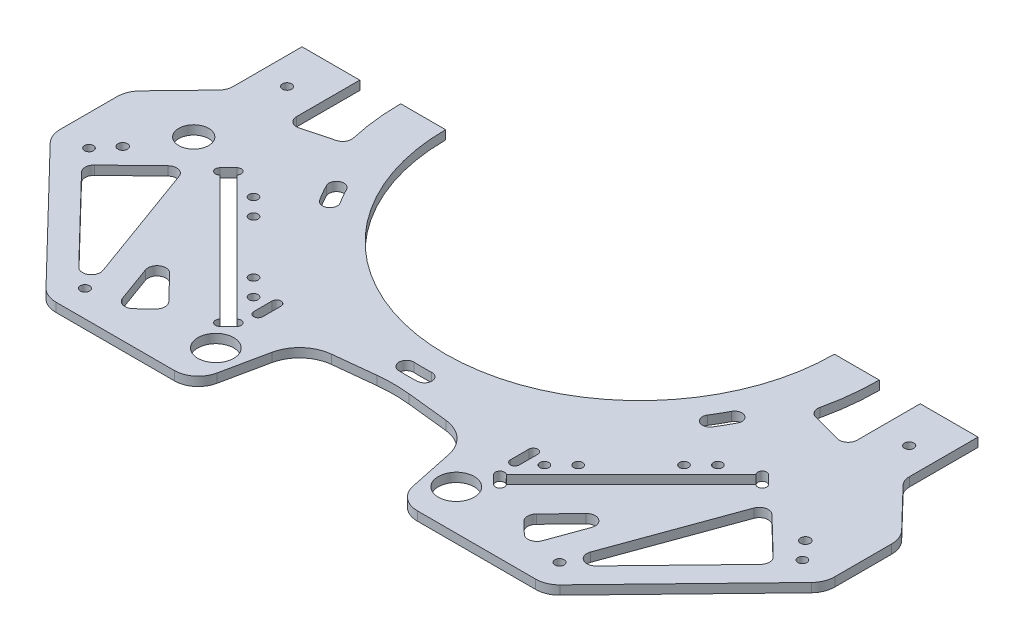
from build123d import *

# Parameters (mm, degrees)
SKETCH_2_R                                 = 1.5
SKETCH_2_R_2                               = 6
SKETCH_2_R_3                               = 2.5
SKETCH_2_R_4                               = 65
EXTRUDE_1_DEPTH                            = 3
CUT_EXTRUDE_1_DEPTH                        = 10
SKETCH_4_W                                 = 371.78166001
SKETCH_4_H                                 = 92.770790776
CUT_EXTRUDE_2_DEPTH                        = 10
CUT_EXTRUDE_3_DEPTH                        = 10
CUT_EXTRUDE_4_DEPTH                        = 10
MIRROR_3_COPY_1_DEPTH                      = 10
MIRROR_3_COPY_2_DEPTH                      = 10
SKETCH_13_R                                = 1.5
CUT_EXTRUDE_7_DEPTH                        = 10
MIRROR_4_AT_THE_SECOND_PLANE_COPY_1_SKET_R = 1.5
MIRROR_4_AT_THE_SECOND_PLANE_COPY_1_DEPTH  = 10
CUT_EXTRUDE_8_DEPTH                        = 10
FILLET_1_R                                 = 10
CUT_EXTRUDE_9_DEPTH                        = 10
FILLET_3_R                                 = 3
MIRROR_START                               = -3
MIRROR_7_DEPTH                             = 3
FILLET_4_R                                 = 10
SKETCH_27_R                                = 6
EXTRUDE_2_DEPTH                            = 3
CUT_EXTRUDE_10_DEPTH                       = 3
MIRROR_11_COPY_1_DEPTH                     = 3
FILLET_5_R                                 = 8
SKETCH_30_R                                = 5
CUT_EXTRUDE_11_DEPTH                       = 3
CUT_EXTRUDE_12_DEPTH                       = 3
FILLET_6_R                                 = 3
CUT_EXTRUDE_13_DEPTH                       = 3
FILLET_7_R                                 = 5
CUT_EXTRUDE_15_DEPTH                       = 10
PATTERN_CIRCULAR_1_COUNT                   = 6
CUT_EXTRUDE_16_DEPTH                       = 3
FILLET_8_R                                 = 8
SKETCH_35_R                                = 1.6
SKETCH_35_R_2                              = 1.55
CUT_EXTRUDE_17_DEPTH                       = 3
SKETCH_36_W                                = 499.129874376
SKETCH_36_H                                = 160.572305111
CUT_EXTRUDE_18_DEPTH                       = 3


# Read off the part's stored shape, not the designer's step: 镜向7
with BuildPart() as part:
    # 草图2 → 凸台-拉伸1 (new body)
    with BuildSketch(Plane(origin=(0, 0, 0), x_dir=(1, 0, 0), z_dir=(0, 1, 0))):
        with BuildLine():
            Line((27.570452121, -570.945673808), (-65.284171465, -616.487071224))
            ThreePointArc((-65.284171465, -616.487071224), (-70.183566605, -620.913167557), (-72, -627.260999566))
            Line((-72, -627.260999566), (-72, -702.260999566))
            ThreePointArc((-72, -702.260999566), (-71.124572855, -706.760319382), (-68.626020199, -710.60316808))
            Line((-68.626020199, -710.60316808), (-4.161661177, -777.260999566))
            Line((-4.161661177, -777.260999566), (18.01022402, -777.260999566))
            ThreePointArc((18.01022402, -777.260999566), (25.574796805, -774.5764297), (29.754765565, -767.723872662))
            Line((29.754765565, -767.723872662), (35.416944963, -740.723008804))
            ThreePointArc((35.416944963, -740.723008804), (39.119130023, -734.339507602), (45.85666052, -731.329367302))
            Line((45.85666052, -731.329367302), (59.628943001, -729.841322608))
            ThreePointArc((59.628943001, -729.841322608), (65, -729.552003017), (70.371056999, -729.841322608))
            Line((70.371056999, -729.841322608), (84.14333948, -731.329367302))
            ThreePointArc((84.14333948, -731.329367302), (90.88747655, -734.345456618), (94.586801163, -740.740390313))
            Line((94.586801163, -740.740390313), (100.245234435, -767.723872662))
            ThreePointArc((100.245234435, -767.723872662), (104.425203195, -774.5764297), (111.98977598, -777.260999566))
            Line((111.98977598, -777.260999566), (134.161661177, -777.260999566))
            Line((134.161661177, -777.260999566), (198.626020199, -710.60316808))
            ThreePointArc((198.626020199, -710.60316808), (201.124572855, -706.760319382), (202, -702.260999566))
            Line((202, -702.260999566), (202, -627.260999566))
            ThreePointArc((202, -627.260999566), (200.183566605, -620.913167557), (195.284171465, -616.487071224))
            Line((195.284171465, -616.487071224), (102.429547879, -570.945673808))
            ThreePointArc((102.429547879, -570.945673808), (65, -562.260999566), (27.570452121, -570.945673808))
        make_face()
        with Locations(Location((-54.25, -712.220291709, 0), (0, 0, 270))):
            Circle(SKETCH_2_R, mode=Mode.SUBTRACT)
        with Locations(Location((24.797056939, -748.876687148, 0), (0, 0, 270))):
            Circle(SKETCH_2_R_2, mode=Mode.SUBTRACT)
        with BuildLine():
            Line((20.591308189, -731.989656145), (20.591308189, -725.864180236))
            ThreePointArc((20.591308189, -725.864180236), (22.091308189, -724.364180236), (23.591308189, -725.864180236))
            Line((23.591308189, -725.864180236), (23.591308189, -731.989656145))
            ThreePointArc((23.591308189, -731.989656145), (22.091308189, -733.489656145), (20.591308189, -731.989656145))
        make_face(mode=Mode.SUBTRACT)
        with Locations(Location((-60, -702.260999566, 0), (0, 0, 270))):
            Circle(SKETCH_2_R_2, mode=Mode.SUBTRACT)
        with Locations(Location((-0.081809094, -684.835999566, 0), (0, 0, 270))):
            Circle(SKETCH_2_R_3, mode=Mode.SUBTRACT)
        with Locations(Location((105.202943061, -748.876687148, 0), (0, 0, 270))):
            Circle(SKETCH_2_R_2, mode=Mode.SUBTRACT)
        with BuildLine():
            ThreePointArc((65, -724.910999566), (62.5, -722.410999566), (65, -719.910999566))
            ThreePointArc((65, -719.910999566), (67.5, -722.410999566), (65, -724.910999566))
        make_face(mode=Mode.SUBTRACT)
        with BuildLine():
            ThreePointArc((106.408691811, -725.864180236), (107.908691811, -724.364180236), (109.408691811, -725.864180236))
            Line((109.408691811, -725.864180236), (109.408691811, -731.989656145))
            ThreePointArc((109.408691811, -731.989656145), (107.908691811, -733.489656145), (106.408691811, -731.989656145))
            Line((106.408691811, -731.989656145), (106.408691811, -725.864180236))
        make_face(mode=Mode.SUBTRACT)
        with Locations(Location((184.25, -712.220291709, 0), (0, 0, 270))):
            Circle(SKETCH_2_R, mode=Mode.SUBTRACT)
        with Locations(Location((130.081809094, -684.835999566, 0), (0, 0, 270))):
            Circle(SKETCH_2_R_3, mode=Mode.SUBTRACT)
        with Locations(Location((190, -702.260999566, 0), (0, 0, 270))):
            Circle(SKETCH_2_R_2, mode=Mode.SUBTRACT)
        with Locations(Location((-60, -627.260999566, 0), (0, 0, 270))):
            Circle(SKETCH_2_R_2, mode=Mode.SUBTRACT)
        with Locations(Location((-54.25, -617.301707422, 0), (0, 0, 270))):
            Circle(SKETCH_2_R, mode=Mode.SUBTRACT)
        with Locations(Location((65, -647.260999566, 0), (0, 0, 270))):
            Circle(SKETCH_2_R_4, mode=Mode.SUBTRACT)
        with Locations(Location((-0.081809094, -609.685999566, 0), (0, 0, 270))):
            Circle(SKETCH_2_R_3, mode=Mode.SUBTRACT)
        with Locations(Location((190, -627.260999566, 0), (0, 0, 270))):
            Circle(SKETCH_2_R_2, mode=Mode.SUBTRACT)
        with Locations(Location((184.25, -617.301707422, 0), (0, 0, 270))):
            Circle(SKETCH_2_R, mode=Mode.SUBTRACT)
        with Locations(Location((130.081809094, -609.685999566, 0), (0, 0, 270))):
            Circle(SKETCH_2_R_3, mode=Mode.SUBTRACT)
        with Locations(Location((65, -572.110999566, 0), (0, 0, 270))):
            Circle(SKETCH_2_R_3, mode=Mode.SUBTRACT)
    extrude(amount=-EXTRUDE_1_DEPTH)

    # 草图3 → 切除-拉伸1 (cut)
    with BuildSketch(Plane(origin=(0, 0, 0), x_dir=(1, 0, 0), z_dir=(0, 1, 0))):
        with BuildLine():
            Line((121.515873197, -588.535574618), (85.947308959, -570.719199778))
            ThreePointArc((85.947308959, -570.719199778), (80.541899521, -572.516670259), (82.339370002, -577.922079697))
            Line((82.339370002, -577.922079697), (117.90793424, -595.738454537))
            ThreePointArc((117.90793424, -595.738454537), (123.313343678, -593.940984056), (121.515873197, -588.535574618))
        make_face()
        with BuildLine():
            ThreePointArc((138.469569232, -635.803502563), (139.848703905, -637.420135509), (141.952746293, -637.717658878))
            Line((141.952746293, -637.717658878), (165.133796995, -632.496332821))
            ThreePointArc((165.133796995, -632.496332821), (166.220460826, -631.256816273), (165.374149259, -629.842250515))
            Line((165.374149259, -629.842250515), (135.315336706, -617.056624431))
            ThreePointArc((135.315336706, -617.056624431), (133.159820875, -617.442493306), (132.649858287, -619.572066372))
            Line((132.649858287, -619.572066372), (138.469569232, -635.803502563))
        make_face()
        with BuildLine():
            ThreePointArc((47.660629998, -577.922079697), (49.458100479, -572.516670259), (44.052691041, -570.719199778))
            Line((44.052691041, -570.719199778), (8.484126803, -588.535574618))
            ThreePointArc((8.484126803, -588.535574618), (6.686656322, -593.940984056), (12.09206576, -595.738454537))
            Line((12.09206576, -595.738454537), (47.660629998, -577.922079697))
        make_face()
        with BuildLine():
            Line((-8.469569232, -635.803502563), (-2.649858287, -619.572066372))
            ThreePointArc((-2.649858287, -619.572066372), (-3.159820875, -617.442493306), (-5.315336706, -617.056624431))
            Line((-5.315336706, -617.056624431), (-35.374149259, -629.842250515))
            ThreePointArc((-35.374149259, -629.842250515), (-36.220460826, -631.256816273), (-35.133796995, -632.496332821))
            Line((-35.133796995, -632.496332821), (-11.952746293, -637.717658878))
            ThreePointArc((-11.952746293, -637.717658878), (-9.848703905, -637.420135509), (-8.469569232, -635.803502563))
        make_face()
        with BuildLine():
            Line((-60, -681.469826556), (-60, -648.052172576))
            ThreePointArc((-60, -648.052172576), (-60.552115569, -645.131724407), (-62.132254377, -642.614382464))
            Line((-62.132254377, -642.614382464), (-68.801618434, -635.417684734))
            ThreePointArc((-68.801618434, -635.417684734), (-71.171826646, -631.64167182), (-72, -627.260999566))
            Line((-72, -627.260999566), (-72, -702.260999566))
            ThreePointArc((-72, -702.260999566), (-71.171826646, -697.880327312), (-68.801618434, -694.104314398))
            Line((-68.801618434, -694.104314398), (-62.132254377, -686.907616668))
            ThreePointArc((-62.132254377, -686.907616668), (-60.552115569, -684.390274725), (-60, -681.469826556))
        make_face()
        with BuildLine():
            ThreePointArc((202, -627.260999566), (201.171826646, -631.64167182), (198.801618434, -635.417684734))
            Line((198.801618434, -635.417684734), (192.132254377, -642.614382464))
            ThreePointArc((192.132254377, -642.614382464), (190.552115569, -645.131724407), (190, -648.052172576))
            Line((190, -648.052172576), (190, -681.469826556))
            ThreePointArc((190, -681.469826556), (190.552115569, -684.390274725), (192.132254377, -686.907616668))
            Line((192.132254377, -686.907616668), (198.801618434, -694.104314398))
            ThreePointArc((198.801618434, -694.104314398), (201.171826646, -697.880327312), (202, -702.260999566))
            Line((202, -702.260999566), (202, -627.260999566))
        make_face()
    extrude(amount=-CUT_EXTRUDE_1_DEPTH, mode=Mode.SUBTRACT)

    # 草图4 → 切除-拉伸2 (cut)
    with BuildSketch(Plane.XZ.offset(3)):
        with Locations((77.214803297, 600.875604178)):
            Rectangle(SKETCH_4_W, SKETCH_4_H)
    extrude(amount=-CUT_EXTRUDE_2_DEPTH, mode=Mode.SUBTRACT)

    # 镜向1: part across plane


with BuildPart() as part_1:
    add(part.part)
    add(part.part.mirror(Plane(origin=(-108.676026708, 7, 647.260999566), x_dir=(1, 0, 0), z_dir=(0, 0, 1))))

    # 草图5 → 切除-拉伸3 (cut)
    with BuildSketch(Plane(origin=(0, 0, 0), x_dir=(1, 0, 0), z_dir=(0, 1, 0))):
        Polygon((110.753152663, -552.567853484), (156.71509344, -598.529794261), (153.886666315, -601.358221386), (107.924725538, -555.396280609), align=None)
    cut_extrude_3 = extrude(amount=-CUT_EXTRUDE_3_DEPTH, mode=Mode.SUBTRACT)

    # 草图6 → 切除-拉伸4 (cut)
    with BuildSketch(Plane(origin=(0, 0, 0), x_dir=(1, 0, 0), z_dir=(0, 1, 0))):
        with BuildLine():
            Line((107.924725538, -555.396280609), (110.753152663, -552.567853484))
            ThreePointArc((110.753152663, -552.567853484), (112.874473006, -552.567853484), (112.874473006, -554.689173828))
            Line((112.874473006, -554.689173828), (110.046045882, -557.517600953))
            ThreePointArc((110.046045882, -557.517600953), (107.924725538, -557.517600953), (107.924725538, -555.396280609))
        make_face()
        with BuildLine():
            Line((151.765345972, -599.236901043), (154.593773096, -596.408473918))
            ThreePointArc((154.593773096, -596.408473918), (156.71509344, -596.408473918), (156.71509344, -598.529794261))
            Line((156.71509344, -598.529794261), (153.886666315, -601.358221386))
            ThreePointArc((153.886666315, -601.358221386), (151.765345972, -601.358221386), (151.765345972, -599.236901043))
        make_face()
    cut_extrude_4 = extrude(amount=-CUT_EXTRUDE_4_DEPTH, mode=Mode.SUBTRACT)

    # 镜向2: 切除-拉伸3, 切除-拉伸4 across plane
    add(cut_extrude_3.mirror(Plane.ZY.offset(-65)), mode=Mode.SUBTRACT)
    add(cut_extrude_4.mirror(Plane.ZY.offset(-65)), mode=Mode.SUBTRACT)

    # 镜向3: 切除-拉伸3, 切除-拉伸4 across plane
    add(cut_extrude_3.mirror(Plane(origin=(0, 0, 647.260999566), x_dir=(1, 0, 0), z_dir=(0, 0, -1))), mode=Mode.SUBTRACT)
    add(cut_extrude_4.mirror(Plane(origin=(0, 0, 647.260999566), x_dir=(1, 0, 0), z_dir=(0, 0, -1))), mode=Mode.SUBTRACT)

    # 镜向3 copy 1 sketch → 镜向3 copy 1 (cut)
    with BuildSketch(Plane(origin=(130, 0, 1294.521999132), x_dir=(-1, 0, 0), z_dir=(0, 1, 0))):
        Polygon((110.753152663, -552.567853484), (156.71509344, -598.529794261), (153.886666315, -601.358221386), (107.924725538, -555.396280609), align=None)
    extrude(amount=-MIRROR_3_COPY_1_DEPTH, mode=Mode.SUBTRACT)

    # 镜向3 copy 2 sketch → 镜向3 copy 2 (cut)
    with BuildSketch(Plane(origin=(130, 0, 1294.521999132), x_dir=(-1, 0, 0), z_dir=(0, 1, 0))):
        with BuildLine():
            Line((107.924725538, -555.396280609), (110.753152663, -552.567853484))
            ThreePointArc((110.753152663, -552.567853484), (112.874473006, -552.567853484), (112.874473006, -554.689173828))
            Line((112.874473006, -554.689173828), (110.046045882, -557.517600953))
            ThreePointArc((110.046045882, -557.517600953), (107.924725538, -557.517600953), (107.924725538, -555.396280609))
        make_face()
        with BuildLine():
            Line((151.765345972, -599.236901043), (154.593773096, -596.408473918))
            ThreePointArc((154.593773096, -596.408473918), (156.71509344, -596.408473918), (156.71509344, -598.529794261))
            Line((156.71509344, -598.529794261), (153.886666315, -601.358221386))
            ThreePointArc((153.886666315, -601.358221386), (151.765345972, -601.358221386), (151.765345972, -599.236901043))
        make_face()
    extrude(amount=-MIRROR_3_COPY_2_DEPTH, mode=Mode.SUBTRACT)

    # 草图13 → 切除-拉伸7 (cut)
    with BuildSketch(Plane.XZ.offset(3)):
        with Locations(Location((113.616935127, 566.674633769, 0), (0, 0, 270))):
            Circle(SKETCH_13_R)
        with Locations(Location((119.273789376, 572.331488018, 0), (0, 0, 270))):
            Circle(SKETCH_13_R)
        with Locations(Location((136.951458906, 590.009157548, 0), (0, 0, 270))):
            Circle(SKETCH_13_R)
        with Locations(Location((142.608313155, 595.666011798, 0), (0, 0, 270))):
            Circle(SKETCH_13_R)
    cut_extrude_7 = extrude(amount=-CUT_EXTRUDE_7_DEPTH, mode=Mode.SUBTRACT)

    # 镜向4: 切除-拉伸7 across plane
    add(cut_extrude_7.mirror(Plane(origin=(0, 0, 647.260999566), x_dir=(1, 0, 0), z_dir=(0, 0, -1))), mode=Mode.SUBTRACT)

    # 镜向4 at the second plane: 切除-拉伸7 across plane
    add(cut_extrude_7.mirror(Plane.ZY.offset(-65)), mode=Mode.SUBTRACT)

    # 镜向4 at the second plane copy 1 sket → 镜向4 at the second plane copy 1 (cut)
    with BuildSketch(Plane(origin=(130, -3, 1294.521999132), x_dir=(-1, 0, 0), z_dir=(0, -1, 0))):
        with Locations(Location((113.616935127, 566.674633769, 0), (0, 0, 270))):
            Circle(MIRROR_4_AT_THE_SECOND_PLANE_COPY_1_SKET_R)
        with Locations(Location((119.273789376, 572.331488018, 0), (0, 0, 270))):
            Circle(MIRROR_4_AT_THE_SECOND_PLANE_COPY_1_SKET_R)
        with Locations(Location((136.951458906, 590.009157548, 0), (0, 0, 270))):
            Circle(MIRROR_4_AT_THE_SECOND_PLANE_COPY_1_SKET_R)
        with Locations(Location((142.608313155, 595.666011798, 0), (0, 0, 270))):
            Circle(MIRROR_4_AT_THE_SECOND_PLANE_COPY_1_SKET_R)
    extrude(amount=-MIRROR_4_AT_THE_SECOND_PLANE_COPY_1_DEPTH, mode=Mode.SUBTRACT)

    # 草图16 → 切除-拉伸8 (cut)
    with BuildSketch(Plane(origin=(0, 0, 0), x_dir=(1, 0, 0), z_dir=(0, 1, 0))):
        Polygon((127.376921237, -517.260999566), (169.256800533, -553.550290589), (134.161661177, -517.260999566), align=None)
    extrude(amount=-CUT_EXTRUDE_8_DEPTH, mode=Mode.SUBTRACT)

    # 圆角1
    # the kernel refuses this fillet: 10 mm, written as the material it takes off along each edge
    with BuildSketch(Plane(origin=(127.376921237, 9.324550734, 517.260999566), x_dir=(-1, 0, 0), z_dir=(0, -1, 0))) as fillet_1_piece_1:
        with BuildLine():
            CenterArc((FILLET_1_R * 0.372982029358, -FILLET_1_R), FILLET_1_R, 90, 40.909222995)
            Line((-FILLET_1_R * 0.281880446846, -FILLET_1_R * 0.244251935325), (0, 0))
            Line((0, 0), (FILLET_1_R * 0.372982029358, 0))
        make_face()
    extrude(amount=21.649101468, mode=Mode.SUBTRACT)
    with BuildSketch(Plane(origin=(169.256800533, 1.102268794, 553.550290589), x_dir=(-0.755748064674862, 0, -0.6548624762041267), z_dir=(0, -1, 0))) as fillet_1_piece_2:
        with BuildLine():
            CenterArc((FILLET_1_R * 0.0440907517567, -FILLET_1_R), FILLET_1_R, 90, 5.049157832)
            Line((-FILLET_1_R * 0.04391966001, -FILLET_1_R * 0.00388044521722), (0, 0))
            Line((0, 0), (FILLET_1_R * 0.0440907517568, 0))
        make_face()
    extrude(amount=5.204537588, mode=Mode.SUBTRACT)

    # 草图17 → 切除-拉伸9 (cut)
    with BuildSketch(Plane.XZ.offset(3)):
        Polygon((124.363711314, 549.018420922), (133.608170415, 540.078164133), (144.388273028, 569.724340914), align=None)
        Polygon((141.696012832, 535.984125249), (162.652120582, 593.615160623), (180.622995997, 576.235642885), align=None)
    extrude(amount=-CUT_EXTRUDE_9_DEPTH, mode=Mode.SUBTRACT)

    # 圆角3
    fillet_3_edges = [part_1.edges().sort_by_distance(p)[0] for p in [
        (180.622995997, -1.5, 576.235642885),
        (141.696012832, -1.5, 535.984125249),
        (162.652120582, -1.5, 593.615160623),
        (124.363711314, -1.5, 549.018420922),
        (144.388273028, -1.5, 569.724340914),
        (133.608170415, -1.5, 540.078164133),
    ]]
    fillet(fillet_3_edges, radius=FILLET_3_R)

    # 镜向7 outline → 镜向7 (cut)
    with BuildSketch(Plane(origin=(0, 0, 0), x_dir=(1, 0, 0), z_dir=(0, 1, 0)).offset(MIRROR_START)):
        with BuildLine():
            Line((-4.601377687, -559.60443543), (3.550746557, -551.174925971))
            ThreePointArc((3.550746557, -551.174925971), (4.393821833, -549.03920548), (3.479783636, -546.932878793))
            Line((3.479783636, -546.932878793), (-0.28369345, -543.29324437))
            ThreePointArc((-0.28369345, -543.29324437), (-3.043472165, -542.526496946), (-5.188625785, -544.424547555))
            Line((-5.188625785, -544.424547555), (-9.577272943, -556.493691436))
            ThreePointArc((-9.577272943, -556.493691436), (-8.348177122, -560.062702211), (-4.601377687, -559.60443543))
        make_face()
        with BuildLine():
            Line((-21.482908173, -546.104030733), (-48.537453868, -574.079137835))
            ThreePointArc((-48.537453868, -574.079137835), (-49.380529145, -576.214858326), (-48.466490947, -578.321185013))
            Line((-48.466490947, -578.321185013), (-35.976597547, -590.400080386))
            ThreePointArc((-35.976597547, -590.400080386), (-33.216818832, -591.16682781), (-31.071665212, -589.268777201))
            Line((-31.071665212, -589.268777201), (-16.507012916, -549.214774726))
            ThreePointArc((-16.507012916, -549.214774726), (-17.736108738, -545.645763952), (-21.482908173, -546.104030733))
        make_face()
        with BuildLine():
            Line((134.601377687, -734.917563702), (126.449253443, -743.347073161))
            ThreePointArc((126.449253443, -743.347073161), (125.606178167, -745.482793652), (126.520216364, -747.589120339))
            Line((126.520216364, -747.589120339), (130.28369345, -751.228754762))
            ThreePointArc((130.28369345, -751.228754762), (133.043472165, -751.995502186), (135.188625785, -750.097451577))
            Line((135.188625785, -750.097451577), (139.577272943, -738.028307696))
            ThreePointArc((139.577272943, -738.028307696), (138.348177122, -734.459296921), (134.601377687, -734.917563702))
        make_face()
        with BuildLine():
            Line((151.482908173, -748.417968399), (178.537453868, -720.442861297))
            ThreePointArc((178.537453868, -720.442861297), (179.380529145, -718.307140806), (178.466490947, -716.200814119))
            Line((178.466490947, -716.200814119), (165.976597547, -704.121918746))
            ThreePointArc((165.976597547, -704.121918746), (163.216818832, -703.355171322), (161.071665212, -705.253221931))
            Line((161.071665212, -705.253221931), (146.507012916, -745.307224406))
            ThreePointArc((146.507012916, -745.307224406), (147.736108738, -748.87623518), (151.482908173, -748.417968399))
        make_face()
        with BuildLine():
            ThreePointArc((3.479783636, -747.589120339), (4.393821833, -745.482793652), (3.550746557, -743.347073161))
            Line((3.550746557, -743.347073161), (-4.601377687, -734.917563702))
            ThreePointArc((-4.601377687, -734.917563702), (-8.348177122, -734.459296921), (-9.577272943, -738.028307696))
            Line((-9.577272943, -738.028307696), (-5.188625785, -750.097451577))
            ThreePointArc((-5.188625785, -750.097451577), (-3.043472165, -751.995502186), (-0.28369345, -751.228754762))
            Line((-0.28369345, -751.228754762), (3.479783636, -747.589120339))
        make_face()
        with BuildLine():
            ThreePointArc((-48.466490947, -716.200814119), (-49.380529145, -718.307140806), (-48.537453868, -720.442861297))
            Line((-48.537453868, -720.442861297), (-21.482908173, -748.417968399))
            ThreePointArc((-21.482908173, -748.417968399), (-17.736108738, -748.87623518), (-16.507012916, -745.307224406))
            Line((-16.507012916, -745.307224406), (-31.071665212, -705.253221931))
            ThreePointArc((-31.071665212, -705.253221931), (-33.216818832, -703.355171322), (-35.976597547, -704.121918746))
            Line((-35.976597547, -704.121918746), (-48.466490947, -716.200814119))
        make_face()
    extrude(amount=MIRROR_7_DEPTH, mode=Mode.SUBTRACT)

    # 圆角4
    fillet_4_edges = [part_1.edges().sort_by_distance(p)[0] for p in [
        (-4.161661177, -1.5, 517.260999566),
        (134.161661177, -1.5, 777.260999566),
        (-4.161661177, -1.5, 777.260999566),
    ]]
    fillet(fillet_4_edges, radius=FILLET_4_R)

    # 草图27 → 凸台-拉伸2 (add)
    with BuildSketch(Plane(origin=(0, 0, 0), x_dir=(1, 0, 0), z_dir=(0, 1, 0))):
        with Locations((190, -702.260999566)):
            Circle(SKETCH_27_R)
        with Locations((190, -592.260999566)):
            Circle(SKETCH_27_R)
        with Locations((-60, -702.260999566)):
            Circle(SKETCH_27_R)
        with Locations((-60, -592.260999566)):
            Circle(SKETCH_27_R)
    extrude(amount=-EXTRUDE_2_DEPTH)

    # 草图29 → 切除-拉伸10 (cut)
    with BuildSketch(Plane(origin=(0, 0, 0), x_dir=(1, 0, 0), z_dir=(0, 1, 0))):
        with BuildLine():
            Line((-18.603091658, -532.193815994), (30.886261292, -532.193815994))
            Line((30.886261292, -532.193815994), (29.754765565, -526.79812647))
            ThreePointArc((29.754765565, -526.79812647), (25.574796805, -519.945569432), (18.01022402, -517.260999566))
            Line((18.01022402, -517.260999566), (0.078801285, -517.260999566))
            ThreePointArc((0.078801285, -517.260999566), (-3.825166507, -518.05453252), (-7.109548881, -520.309192471))
            Line((-7.109548881, -520.309192471), (-18.603091658, -532.193815994))
        make_face()
    cut_extrude_10 = extrude(amount=-CUT_EXTRUDE_10_DEPTH, mode=Mode.SUBTRACT)

    # 镜向10: 切除-拉伸10 across plane
    add(cut_extrude_10.mirror(Plane.ZY.offset(-65)), mode=Mode.SUBTRACT)

    # 镜向11: 切除-拉伸10 across plane
    add(cut_extrude_10.mirror(Plane(origin=(0, 0, 647.260999566), x_dir=(1, 0, 0), z_dir=(0, 0, -1))), mode=Mode.SUBTRACT)

    # 镜向11 copy 1 sketch → 镜向11 copy 1 (cut)
    with BuildSketch(Plane(origin=(130, 0, 1294.521999132), x_dir=(-1, 0, 0), z_dir=(0, 1, 0))):
        with BuildLine():
            Line((-18.603091658, -532.193815994), (30.886261292, -532.193815994))
            Line((30.886261292, -532.193815994), (29.754765565, -526.79812647))
            ThreePointArc((29.754765565, -526.79812647), (25.574796805, -519.945569432), (18.01022402, -517.260999566))
            Line((18.01022402, -517.260999566), (0.078801285, -517.260999566))
            ThreePointArc((0.078801285, -517.260999566), (-3.825166507, -518.05453252), (-7.109548881, -520.309192471))
            Line((-7.109548881, -520.309192471), (-18.603091658, -532.193815994))
        make_face()
    extrude(amount=-MIRROR_11_COPY_1_DEPTH, mode=Mode.SUBTRACT)

    # 圆角5
    fillet_5_edges = [part_1.edges().sort_by_distance(p)[0] for p in [
        (-18.603091658, -1.5, 532.193815994),
        (30.886261292, -1.5, 532.193815994),
        (144.610229795, -1.5, 532.193815994),
        (99.113758937, -1.5, 532.193815994),
        (99.113758937, -1.5, 762.328183138),
        (148.603091658, -1.5, 762.328183138),
        (30.886261292, -1.5, 762.328183138),
        (-18.603091658, -1.5, 762.328183138),
    ]]
    fillet(fillet_5_edges, radius=FILLET_5_R)

    # 草图30 → 切除-拉伸11 (cut)
    with BuildSketch(Plane(origin=(0, 0, 0), x_dir=(1, 0, 0), z_dir=(0, 1, 0))):
        with Locations(Location((-40, -601.469826556, 0), (0, 0, 270))):
            Circle(SKETCH_30_R)
        with Locations(Location((-40, -691.469826556, 0), (0, 0, 270))):
            Circle(SKETCH_30_R)
    extrude(amount=-CUT_EXTRUDE_11_DEPTH, mode=Mode.SUBTRACT)

    # 草图31 → 切除-拉伸12 (cut)
    with BuildSketch(Plane(origin=(0, 0, 0), x_dir=(1, 0, 0), z_dir=(0, 1, 0))):
        with BuildLine():
            Line((-28.694443352, -622.260999566), (-28.694443352, -672.260999566))
            Line((-28.694443352, -672.260999566), (-12.295751474, -667.885422079))
            ThreePointArc((-12.295751474, -667.885422079), (-15, -647.260999566), (-12.295751474, -626.636577053))
            Line((-12.295751474, -626.636577053), (-28.694443352, -622.260999566))
        make_face()
        with BuildLine():
            Line((158.694443352, -622.260999566), (158.694443352, -672.260999566))
            Line((158.694443352, -672.260999566), (142.295751474, -667.885422079))
            ThreePointArc((142.295751474, -667.885422079), (145, -647.260999566), (142.295751474, -626.636577053))
            Line((142.295751474, -626.636577053), (158.694443352, -622.260999566))
        make_face()
    extrude(amount=-CUT_EXTRUDE_12_DEPTH, mode=Mode.SUBTRACT)

    # 圆角6
    fillet_6_edges = [part_1.edges().sort_by_distance(p)[0] for p in [
        (142.295751474, -1.5, 626.636577053),
        (158.694443352, -1.5, 622.260999566),
        (158.694443352, -1.5, 672.260999566),
        (142.295751474, -1.5, 667.885422079),
        (-28.694443352, -1.5, 622.260999566),
        (-12.295751474, -1.5, 626.636577053),
        (-12.295751474, -1.5, 667.885422079),
        (-28.694443352, -1.5, 672.260999566),
    ]]
    fillet(fillet_6_edges, radius=FILLET_6_R)

    # 草图32 → 切除-拉伸13 (cut)
    with BuildSketch(Plane(origin=(0, 0, 0), x_dir=(1, 0, 0), z_dir=(0, 1, 0))):
        with BuildLine():
            Line((-62.132254377, -607.614382464), (-48, -622.260999566))
            Line((-48, -622.260999566), (-48, -672.260999566))
            Line((-48, -672.260999566), (-62.132254377, -686.907616668))
            ThreePointArc((-62.132254377, -686.907616668), (-60.552115569, -684.390274725), (-60, -681.469826556))
            Line((-60, -681.469826556), (-60, -648.052172576))
            ThreePointArc((-60, -648.052172576), (-60.009810591, -647.656100358), (-60.0392183, -647.260999566))
            ThreePointArc((-60.0392183, -647.260999566), (-60.009810591, -646.865898774), (-60, -646.469826556))
            Line((-60, -646.469826556), (-60, -613.052172576))
            ThreePointArc((-60, -613.052172576), (-60.552115569, -610.131724407), (-62.132254377, -607.614382464))
        make_face()
        with BuildLine():
            Line((192.132254377, -686.907616668), (178, -672.260999566))
            Line((178, -672.260999566), (178, -622.260999566))
            Line((178, -622.260999566), (192.132254377, -607.614382464))
            ThreePointArc((192.132254377, -607.614382464), (190.552115569, -610.131724407), (190, -613.052172576))
            Line((190, -613.052172576), (190, -646.469826556))
            ThreePointArc((190, -646.469826556), (190.009810591, -646.865898774), (190.0392183, -647.260999566))
            ThreePointArc((190.0392183, -647.260999566), (190.009810591, -647.656100358), (190, -648.052172576))
            Line((190, -648.052172576), (190, -681.469826556))
            ThreePointArc((190, -681.469826556), (190.552115569, -684.390274725), (192.132254377, -686.907616668))
        make_face()
    extrude(amount=-CUT_EXTRUDE_13_DEPTH, mode=Mode.SUBTRACT)

    # 圆角7
    fillet_7_edges = [part_1.edges().sort_by_distance(p)[0] for p in [
        (-48, -1.5, 622.260999566),
        (-48, -1.5, 672.260999566),
        (178, -1.5, 672.260999566),
        (178, -1.5, 622.260999566),
    ]]
    fillet(fillet_7_edges, radius=FILLET_7_R)

    # 草图33 → 切除-拉伸15 (cut)
    with BuildSketch(Plane(origin=(0, 0, 0), x_dir=(1, 0, 0), z_dir=(0, 1, 0))):
        with BuildLine():
            ThreePointArc((68.099800399, -569.672896499), (65, -569.610999566), (61.900199601, -569.672896499))
            ThreePointArc((61.900199601, -569.672896499), (59.501992818, -572.27070408), (62.099800399, -574.668910863))
            ThreePointArc((62.099800399, -574.668910863), (65, -574.610999566), (67.900199601, -574.668910863))
            ThreePointArc((67.900199601, -574.668910863), (70.498007182, -572.27070408), (68.099800399, -569.672896499))
        make_face()
        with BuildLine():
            ThreePointArc((-569.672896499, -68.099800399), (-569.610999566, -65), (-569.672896499, -61.900199601))
            ThreePointArc((-569.672896499, -61.900199601), (-572.27070408, -59.501992818), (-574.668910863, -62.099800399))
            ThreePointArc((-574.668910863, -62.099800399), (-574.610999566, -65), (-574.668910863, -67.900199601))
            ThreePointArc((-574.668910863, -67.900199601), (-572.27070408, -70.498007182), (-569.672896499, -68.099800399))
        make_face()
        with BuildLine():
            ThreePointArc((-68.099800399, 569.672896499), (-65, 569.610999566), (-61.900199601, 569.672896499))
            ThreePointArc((-61.900199601, 569.672896499), (-59.501992818, 572.27070408), (-62.099800399, 574.668910863))
            ThreePointArc((-62.099800399, 574.668910863), (-65, 574.610999566), (-67.900199601, 574.668910863))
            ThreePointArc((-67.900199601, 574.668910863), (-70.498007182, 572.27070408), (-68.099800399, 569.672896499))
        make_face()
        with BuildLine():
            ThreePointArc((569.672896499, 68.099800399), (569.610999566, 65), (569.672896499, 61.900199601))
            ThreePointArc((569.672896499, 61.900199601), (572.27070408, 59.501992818), (574.668910863, 62.099800399))
            ThreePointArc((574.668910863, 62.099800399), (574.610999566, 65), (574.668910863, 67.900199601))
            ThreePointArc((574.668910863, 67.900199601), (572.27070408, 70.498007182), (569.672896499, 68.099800399))
        make_face()
    cut_extrude_15 = extrude(amount=-CUT_EXTRUDE_15_DEPTH, mode=Mode.SUBTRACT)

    # 阵列(圆周)1: 切除-拉伸15 ×6 about axis
    pattern_circular_1_axis = Axis((65, 0, 647.260999566), (0, 1, 0))
    for i in range(1, PATTERN_CIRCULAR_1_COUNT):
        add(cut_extrude_15.rotate(pattern_circular_1_axis, i * 360 / PATTERN_CIRCULAR_1_COUNT), mode=Mode.SUBTRACT)

    # 草图34 → 切除-拉伸16 (cut)
    with BuildSketch(Plane(origin=(0, 0, 0), x_dir=(1, 0, 0), z_dir=(0, 1, 0))):
        with BuildLine():
            Line((-68.626020199, -583.918831052), (-64.5, -579.652418365))
            Line((-64.5, -579.652418365), (-64.5, -605.05942379))
            Line((-64.5, -605.05942379), (-68.801618434, -600.417684734))
            ThreePointArc((-68.801618434, -600.417684734), (-71.99932041, -592.133290118), (-68.626020199, -583.918831052))
        make_face()
        with BuildLine():
            Line((-64.5, -714.869580767), (-64.5, -689.462575342))
            Line((-64.5, -689.462575342), (-68.801618434, -694.104314398))
            ThreePointArc((-68.801618434, -694.104314398), (-71.99932041, -702.388709013), (-68.626020199, -710.60316808))
            Line((-68.626020199, -710.60316808), (-64.5, -714.869580767))
        make_face()
        with BuildLine():
            Line((198.626020199, -710.60316808), (194.5, -714.869580767))
            Line((194.5, -714.869580767), (194.5, -689.462575342))
            Line((194.5, -689.462575342), (198.801618434, -694.104314398))
            ThreePointArc((198.801618434, -694.104314398), (201.99932041, -702.388709013), (198.626020199, -710.60316808))
        make_face()
        with BuildLine():
            Line((194.5, -579.652418365), (194.5, -605.05942379))
            Line((194.5, -605.05942379), (198.801618434, -600.417684734))
            ThreePointArc((198.801618434, -600.417684734), (201.99932041, -592.133290118), (198.626020199, -583.918831052))
            Line((198.626020199, -583.918831052), (194.5, -579.652418365))
        make_face()
    extrude(amount=-CUT_EXTRUDE_16_DEPTH, mode=Mode.SUBTRACT)

    # 圆角8
    fillet_8_edges = [part_1.edges().sort_by_distance(p)[0] for p in [
        (194.5, -1.5, 579.652418365),
        (194.5, -1.5, 605.05942379),
        (194.5, -1.5, 714.869580767),
        (194.5, -1.5, 689.462575342),
        (-64.5, -1.5, 714.869580767),
        (-64.5, -1.5, 689.462575342),
        (-64.5, -1.5, 579.652418365),
        (-64.5, -1.5, 605.05942379),
    ]]
    fillet(fillet_8_edges, radius=FILLET_8_R)

    # 草图35 → 切除-拉伸17 (cut)
    with BuildSketch(Plane(origin=(0, 0, 0), x_dir=(1, 0, 0), z_dir=(0, 1, 0))):
        with Locations(Location((-49.107699123, -588.430062967, 0), (0, 0, 270))):
            Circle(SKETCH_35_R)
        with Locations(Location((179.107699123, -588.430062967, 0), (0, 0, 270))):
            Circle(SKETCH_35_R)
        with Locations(Location((179.107699123, -706.091936165, 0), (0, 0, 270))):
            Circle(SKETCH_35_R)
        with Locations(Location((-49.107699123, -706.091936165, 0), (0, 0, 270))):
            Circle(SKETCH_35_R)
        with Locations(Location((169, -633.260999566, 0), (0, 0, 270))):
            Circle(SKETCH_35_R_2)
        with Locations(Location((169, -661.260999566, 0), (0, 0, 270))):
            Circle(SKETCH_35_R_2)
        with Locations(Location((-39, -661.260999566, 0), (0, 0, 270))):
            Circle(SKETCH_35_R_2)
        with Locations(Location((-39, -633.260999566, 0), (0, 0, 270))):
            Circle(SKETCH_35_R_2)
        with Locations(Location((-14.332218974, -753.49632022, 0), (0, 0, 270))):
            Circle(SKETCH_35_R_2)
        with Locations(Location((-14.332218974, -541.025678912, 0), (0, 0, 270))):
            Circle(SKETCH_35_R_2)
        with Locations(Location((144.332218974, -753.49632022, 0), (0, 0, 270))):
            Circle(SKETCH_35_R_2)
        with Locations(Location((144.332218974, -541.025678912, 0), (0, 0, 270))):
            Circle(SKETCH_35_R_2)
    extrude(amount=-CUT_EXTRUDE_17_DEPTH, mode=Mode.SUBTRACT)

    # 草图36 → 切除-拉伸18 (cut)
    with BuildSketch(Plane(origin=(0, 0, 0), x_dir=(1, 0, 0), z_dir=(0, 1, 0))):
        with Locations((130.190952839, -566.974847011)):
            Rectangle(SKETCH_36_W, SKETCH_36_H)
    extrude(amount=-CUT_EXTRUDE_18_DEPTH, mode=Mode.SUBTRACT)


solid = part_1.part
